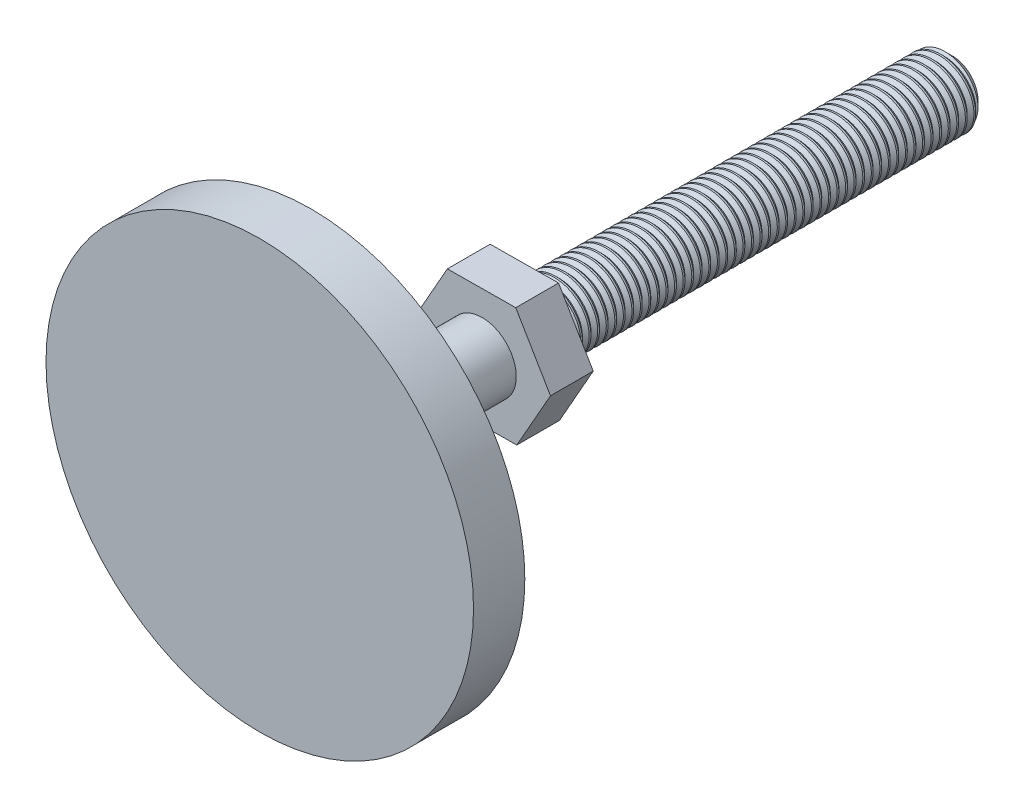
from build123d import *

# Parameters (mm, degrees)
SKETCH_1_R      = 25
EXTRUDE_1_DEPTH = 6
SKETCH_3_R      = 5
EXTRUDE_2_DEPTH = 3
CHAMFER_1_SIZE  = 1
SKETCH_4_R      = 4
EXTRUDE_3_DEPTH = 7
EXTRUDE_5_DEPTH = 5
SKETCH_6_R      = 4
EXTRUDE_6_DEPTH = 50
CHAMFER_2_SIZE  = 1
SWEEP_2_PITCH   = 1


with BuildPart() as part:
    # 草图1 → 凸台-拉伸1 (new body)
    with BuildSketch(Plane.XY):
        Circle(SKETCH_1_R)
    extrude(amount=EXTRUDE_1_DEPTH)

    # 草图2 → 旋转1 (revolve)
    with BuildSketch(Plane(origin=(0, 0, 0), x_dir=(0, 0, -1), z_dir=(1, 0, 0)), mode=Mode.PRIVATE) as revolve_1_sk:
        Polygon((0, 0), (10, 0), (10, 9.653956113), (0, 25), align=None)
    revolve(revolve_1_sk.sketch.rotate(Axis((0, 0, 0), (0, 0, -1)), 90), axis=Axis((0, 0, 0), (0, 0, -1)))

    # 草图3 → 凸台-拉伸2 (add)
    with BuildSketch(Plane(origin=(0, 0, -10), x_dir=(-1, 0, 0), z_dir=(0, 0, -1))):
        with Locations(Location((0, 0, 0), (0, 0, 180))):
            Circle(SKETCH_3_R)
    extrude(amount=EXTRUDE_2_DEPTH)

    # 倒角1
    chamfer_1_edges = [part.edges().sort_by_distance(p)[0] for p in [
        (-5, 0, -13),
    ]]
    chamfer(chamfer_1_edges, length=CHAMFER_1_SIZE)

    # 草图4 → 凸台-拉伸3 (add)
    with BuildSketch(Plane(origin=(0, 0, -13), x_dir=(-1, 0, 0), z_dir=(0, 0, -1))):
        Circle(SKETCH_4_R)
    extrude(amount=EXTRUDE_3_DEPTH)

    # 草图5 → 凸台-拉伸5 (add)
    with BuildSketch(Plane(origin=(0, 0, -20), x_dir=(-1, 0, 0), z_dir=(0, 0, -1))):
        Polygon((4.059074532, 6.893759058), (-3.940633206, 6.962141189), (-7.999707737, 0.068382131), (-4.059074532, -6.893759058), (3.940633206, -6.962141189), (7.999707737, -0.068382131), align=None)
    extrude(amount=EXTRUDE_5_DEPTH)

    # 草图6 → 凸台-拉伸6 (add)
    with BuildSketch(Plane(origin=(0, 0, -25), x_dir=(-1, 0, 0), z_dir=(0, 0, -1))):
        Circle(SKETCH_6_R)
    extrude(amount=EXTRUDE_6_DEPTH)

    # 倒角2
    chamfer_2_edges = [part.edges().sort_by_distance(p)[0] for p in [
        (4, 0, -75),
    ]]
    chamfer(chamfer_2_edges, length=CHAMFER_2_SIZE)

    # 切除-扫描2: arcs per turn and ends read off the stored shape
    # 切除-扫描2: the profile of 草图10 profile screwed along a right-hand helix through 50 turns, 8 arcs to a turn; built about Z, then put on its axis
    sweep_2_z = Axis((0, 0, 0), (0, 0, 1))
    sweep_2_corners = [(4.0003, 0, 0.4003), (4.0003, 0, -0.4003), (3.6, 0, 0)]
    with BuildLine(mode=Mode.PRIVATE) as sweep_2_profile:
        Line(sweep_2_corners[0], sweep_2_corners[1])
        Line(sweep_2_corners[1], sweep_2_corners[2])
        Line(sweep_2_corners[2], sweep_2_corners[0])
    sweep_2_cap = Face(sweep_2_profile.wire())
    sweep_2_turn_angles = [0, 22.5, 45, 67.5, 90, 112.5, 135, 157.5, 180, 202.5, 225, 247.5, 270, 292.5, 315, 337.5, 360]
    sweep_2_turn_weights = [1, 0.9238795325112867, 1, 0.9238795325112867, 1, 0.9238795325112867, 1, 0.9238795325112867, 1, 0.9238795325112867, 1, 0.9238795325112867, 1, 0.9238795325112867, 1, 0.9238795325112867, 1]
    sweep_2_turn_rails = [Edge.make_bspline([Vector(p[0], p[1], 0).rotate(sweep_2_z, sweep_2_turn_angles[k]) / sweep_2_turn_weights[k] + Vector(0, 0, p[2] + SWEEP_2_PITCH * sweep_2_turn_angles[k] / 360) for k in range(17)], [0, 0, 0, 1, 1, 2, 2, 3, 3, 4, 4, 5, 5, 6, 6, 7, 7, 8, 8, 8], 2, sweep_2_turn_weights) for p in sweep_2_corners]
    sweep_2_turn_sides = [Face.make_surface_from_curves(sweep_2_turn_rails[p[0]], sweep_2_turn_rails[p[1]]) for p in [(0, 1), (1, 2), (2, 0)]]
    sweep_2 = Plane(origin=(0, 0, -75), x_dir=(0.7071067811865512, 0.7071067811865438, 0), z_dir=(0, 0, 1)) * Solid(Shell([*[p.moved(Location((0, 0, SWEEP_2_PITCH * i))) for i in range(50) for p in sweep_2_turn_sides], sweep_2_cap, sweep_2_cap.rotate(sweep_2_z, 18000).moved(Location((0, 0, SWEEP_2_PITCH * 18000 / 360)))]))
    add(sweep_2, mode=Mode.SUBTRACT)


solid = part.part
